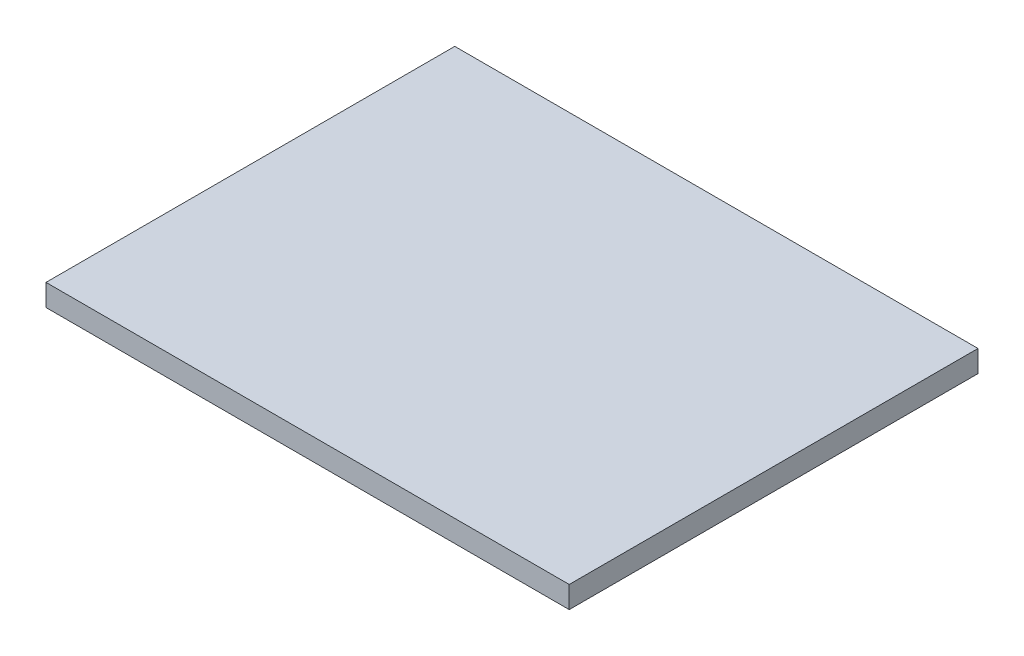
from build123d import *

# Parameters (mm, degrees)
SKETCH1_W           = 96
SKETCH1_H           = 75
BOSS_EXTRUDE1_DEPTH = 4


with BuildPart() as part:
    # Sketch1 → Boss-Extrude1 (new body)
    with BuildSketch(Plane(origin=(0, 72.59, 0), x_dir=(1, 0, 0), z_dir=(0, 1, 0))):
        with Locations((50, 37.5)):
            Rectangle(SKETCH1_W, SKETCH1_H)
    extrude(amount=-BOSS_EXTRUDE1_DEPTH)


solid = part.part
